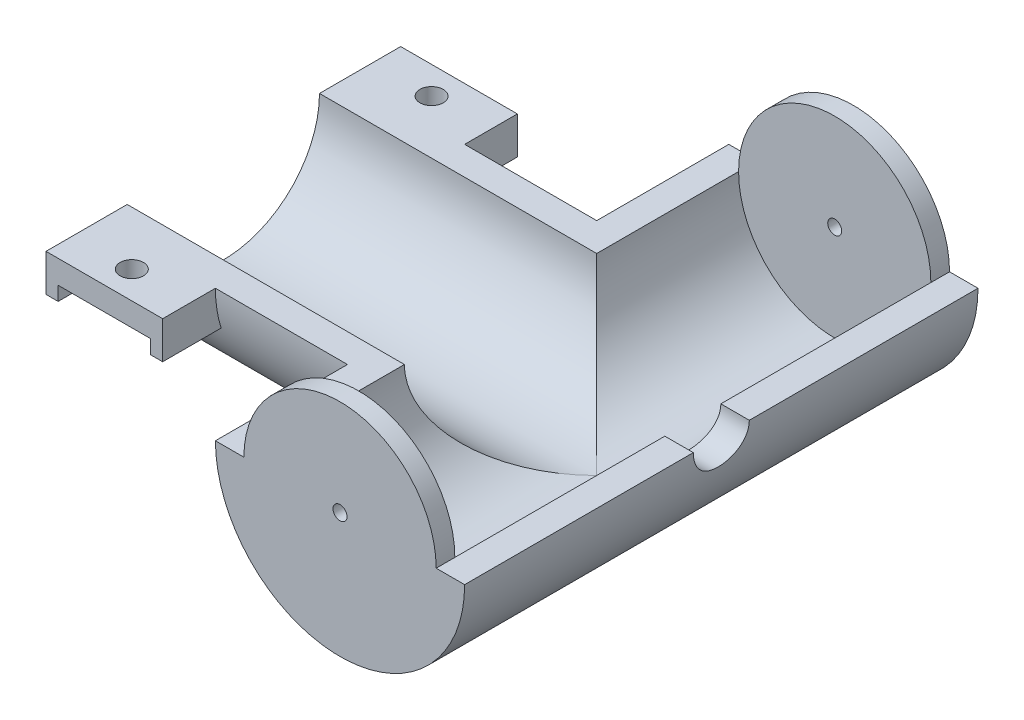
from build123d import *

# Parameters (mm, degrees)
SKETCH1_R                = 16.9545
BOSS_EXTRUDE1_DEPTH      = 50.8
SKETCH2_R                = 16.9545
BOSS_EXTRUDE2_DEPTH      = 34.925
SKETCH3_R                = 13.081
CUT_EXTRUDE1_DEPTH       = 50.8
SKETCH5_R                = 13.081
CUT_EXTRUDE2_DEPTH       = 69.85
CUT_EXTRUDE4_DEPTH       = 79.088942658
CUT_EXTRUDE4_DEPTH_BACK  = 79.088942658
SKETCH6_R                = 3.81
BOSS_EXTRUDE3_REACH      = 93.464
BOSS_EXTRUDE3_END_RADIUS = 16.9545
SKETCH8_W                = 15.875
SKETCH8_H                = 5.08
CUT_EXTRUDE5_REACH       = 93.464
CUT_EXTRUDE5_END_RADIUS  = 16.9545
SKETCH9_W                = 12.573
SKETCH9_H                = 1.905
SKETCH10_R               = 1.5875
CUT_EXTRUDE6_DEPTH       = 78.461619779
SKETCH11_R               = 13.081
BOSS_EXTRUDE4_DEPTH      = 2.54
SKETCH13_R               = 0.9525
CUT_EXTRUDE8_DEPTH       = 99.778286437


with BuildPart() as part:
    # Sketch1 → Boss-Extrude1 (new body)
    with BuildSketch(Plane(origin=(0, 0, 0), x_dir=(0, 0, -1), z_dir=(1, 0, 0))):
        Circle(SKETCH1_R)
    extrude(amount=BOSS_EXTRUDE1_DEPTH)

    # Sketch2 → Boss-Extrude2 (add, symmetric)
    with BuildSketch(Plane.XY):
        with Locations((50.8, 0)):
            Circle(SKETCH2_R)
    extrude(amount=BOSS_EXTRUDE2_DEPTH, both=True)

    # Sketch3 → Cut-Extrude1 (cut)
    with BuildSketch(Plane.ZY):
        Circle(SKETCH3_R)
    extrude(amount=-CUT_EXTRUDE1_DEPTH, mode=Mode.SUBTRACT)

    # Sketch5 → Cut-Extrude2 (cut)
    with BuildSketch(Plane(origin=(0, 0, -34.925), x_dir=(-1, 0, 0), z_dir=(0, 0, -1))):
        with Locations((-50.8, 0)):
            Circle(SKETCH5_R)
    extrude(amount=-CUT_EXTRUDE2_DEPTH, mode=Mode.SUBTRACT)

    # Sketch6 → Cut-Extrude4 (cut, two sides: drawn at the far end of the back side and taken through both)
    with BuildSketch(Plane(origin=(0, 0, 0), x_dir=(0, 0, -1), z_dir=(1, 0, 0)).offset(-CUT_EXTRUDE4_DEPTH_BACK)):
        with Locations(Location((0, 0, 0), (0, 0, 180))):
            Circle(SKETCH6_R)
    extrude(amount=CUT_EXTRUDE4_DEPTH + CUT_EXTRUDE4_DEPTH_BACK, mode=Mode.SUBTRACT)

    # SurfaceCut1
    split(bisect_by=Plane(origin=(0, 0, 0), x_dir=(1, 0, 0), z_dir=(0, 1, 0)), keep=Keep.BOTTOM)


with BuildPart() as body_2:
    # Boss-Extrude3: up to this cylinder (the profile starts outside it)
    boss_extrude3_end = Plane(origin=(7.9375, 0, 0), z_dir=(-1, 0, 0)) * Cylinder(BOSS_EXTRUDE3_END_RADIUS, 221.837, mode=Mode.PRIVATE)
    # Sketch8 → Boss-Extrude3 (new, up to the surface)
    with BuildSketch(Plane.XY.offset(24.13), mode=Mode.PRIVATE) as boss_extrude3_sk1:
        with Locations((7.9375, -2.54)):
            Rectangle(SKETCH8_W, SKETCH8_H)
    boss_extrude3_tool1 = extrude(boss_extrude3_sk1.sketch, amount=-BOSS_EXTRUDE3_REACH, mode=Mode.PRIVATE) - boss_extrude3_end
    add(boss_extrude3_tool1.solids().sort_by_distance((7.9375, -2.54, 24.13))[0])

    # Cut-Extrude5: up to this cylinder (the profile starts outside it)
    cut_extrude5_end = Plane(origin=(7.9375, 0, 0), z_dir=(-1, 0, 0)) * Cylinder(CUT_EXTRUDE5_END_RADIUS, 221.837, mode=Mode.PRIVATE)
    # Sketch9 → Cut-Extrude5 (cut, up to the surface)
    with BuildSketch(Plane.XY.offset(24.13), mode=Mode.PRIVATE) as cut_extrude5_sk1:
        with Locations((7.9375, -4.1275)):
            Rectangle(SKETCH9_W, SKETCH9_H)
    cut_extrude5_tool1 = extrude(cut_extrude5_sk1.sketch, amount=-CUT_EXTRUDE5_REACH, mode=Mode.PRIVATE) - cut_extrude5_end
    add(cut_extrude5_tool1.solids().sort_by_distance((7.9375, -4.1275, 24.13))[0], mode=Mode.SUBTRACT)


with BuildPart() as body_3:
    # Mirror1: mirrored copy
    add(body_2.part.mirror(Plane.XY))


with BuildPart() as part_1:
    add(part.part)

    # Intersect1: read off the stored shape, not the designer's step
    # Intersect1: union body 3, body 2
    add(body_3.part)
    add(body_2.part)

    # Sketch10 → Cut-Extrude6 (cut, through all)
    with BuildSketch(Plane.XZ.offset(3.175)):
        with Locations(Location((7.9375, 20.392281148, 0), (0, 0, 270))):
            Circle(SKETCH10_R)
    cut_extrude6 = extrude(amount=-CUT_EXTRUDE6_DEPTH, mode=Mode.SUBTRACT)

    # Mirror2: Cut-Extrude6 across plane
    add(cut_extrude6.mirror(Plane.XY), mode=Mode.SUBTRACT)

    # Sketch11 → Boss-Extrude4 (add)
    with BuildSketch(Plane(origin=(0, 0, -34.925), x_dir=(-1, 0, 0), z_dir=(0, 0, -1))):
        with Locations((-50.8, 0)):
            Circle(SKETCH11_R)
    boss_extrude4 = extrude(amount=-BOSS_EXTRUDE4_DEPTH)

    # Mirror3: Boss-Extrude4 across plane
    add(boss_extrude4.mirror(Plane.XY))

    # Sketch13 → Cut-Extrude8 (cut, through all)
    with BuildSketch(Plane(origin=(0, 0, -34.925), x_dir=(-1, 0, 0), z_dir=(0, 0, -1))):
        with Locations((-50.8, 0)):
            Circle(SKETCH13_R)
    extrude(amount=-CUT_EXTRUDE8_DEPTH, mode=Mode.SUBTRACT)


solid = part_1.part
